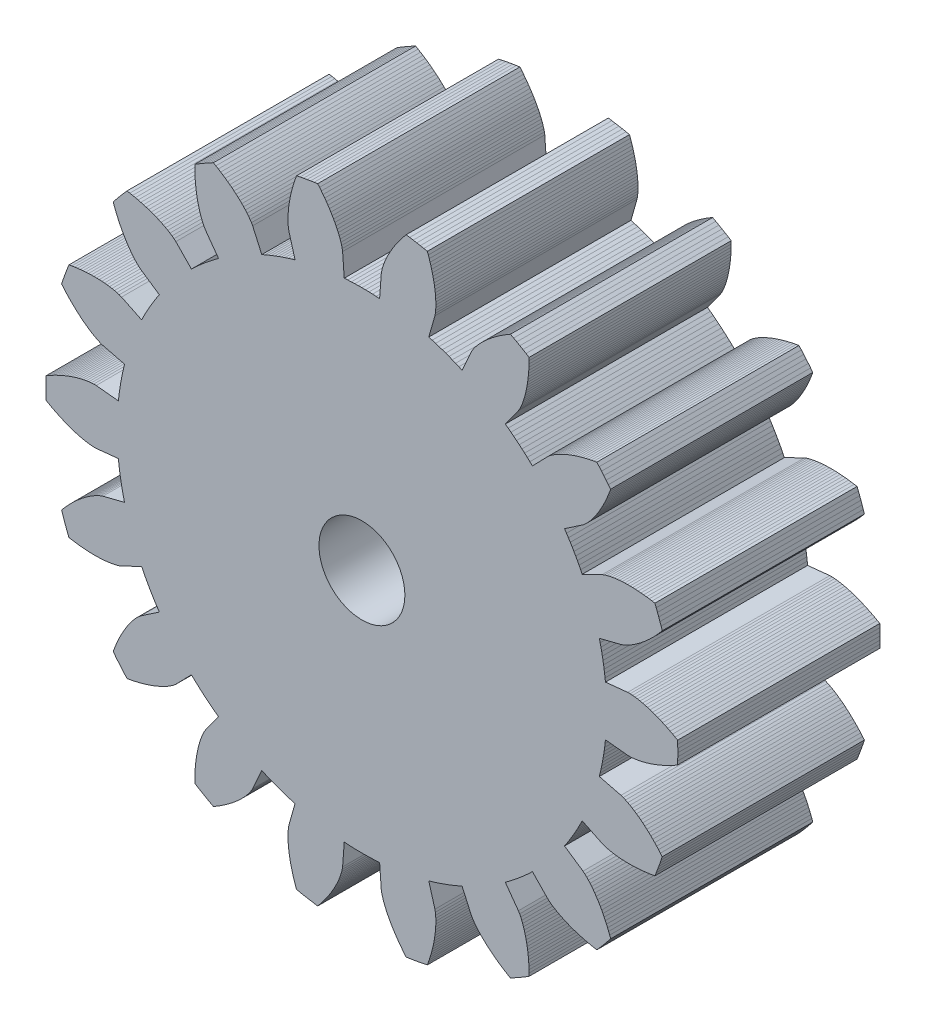
from build123d import *

# Parameters (mm, degrees)
GEAR_PROFILE_M1_25_Z18_R = 1.7
GEAR_BODY_8MM_DEPTH      = 8


with BuildPart() as part:
    # Gear Profile m1. 25 z18 → Gear body 8mm (new body)
    with BuildSketch(Plane.XY):
        Polygon((9.636980636, -0.988058941), (10.516412427, -1.078225195), (10.613218889, -1.07937926), (10.710753758, -1.073218678), (10.808746631, -1.062169966), (10.907089809, -1.047072003), (11.005713175, -1.028396453), (11.104563136, -1.006453141), (11.203595091, -0.981463589), (11.302769944, -0.953595023), (11.40205224, -0.922978585), (11.501409069, -0.889720074), (11.600809369, -0.853906748), (11.700223467, -0.815611865), (11.799622753, -0.77489784), (11.898979455, -0.731818518), (11.998266467, -0.686420855), (12.097457222, -0.638746191), (12.196525595, -0.588831234), (12.295445827, -0.536708834), (12.394192463, -0.482408597), (12.492740304, -0.425957384), (12.496773295, -0.284002137), (12.499193298, -0.142010233), (12.5, 0), (12.499193298, 0.142010233), (12.496773295, 0.284002137), (12.492740304, 0.425957384), (12.394192463, 0.482408597), (12.295445827, 0.536708834), (12.196525595, 0.588831234), (12.097457222, 0.638746191), (11.998266467, 0.686420855), (11.898979455, 0.731818518), (11.799622753, 0.77489784), (11.700223467, 0.815611865), (11.600809369, 0.853906748), (11.501409069, 0.889720074), (11.40205224, 0.922978585), (11.302769944, 0.953595023), (11.203595091, 0.981463589), (11.104563136, 1.006453141), (11.005713175, 1.028396453), (10.907089809, 1.047072003), (10.808746631, 1.062169966), (10.710753758, 1.073218678), (10.613218889, 1.07937926), (10.516412427, 1.078225195), (9.636980636, 0.988058941), (9.621672316, 1.127420989), (9.604348765, 1.266546903), (9.585013609, 1.405407542), (9.5636709, 1.543973822), (9.540325107, 1.682216721), (9.51498112, 1.820107285), (9.487644248, 1.957616632), (9.458320215, 2.094715962), (9.427015164, 2.23137656), (9.393735651, 2.367569803), (10.250969891, 2.583624627), (10.342332922, 2.61564992), (10.431878675, 2.654797864), (10.520182973, 2.698695793), (10.607431524, 2.746518585), (10.693719759, 2.797799039), (10.779103284, 2.852227685), (10.863615951, 2.909581107), (10.947278217, 2.96968879), (11.03010162, 3.032415376), (11.112091418, 3.09765019), (11.193248268, 3.165300613), (11.27356934, 3.235287656), (11.353049099, 3.307542883), (11.431679863, 3.382006198), (11.50945222, 3.458624205), (11.586355345, 3.537348971), (11.662377244, 3.618137067), (11.737504946, 3.700948813), (11.811724655, 3.785747684), (11.885021883, 3.872499819), (11.840260101, 4.007273481), (11.793970068, 4.141529915), (11.74615776, 4.275251792), (11.696829347, 4.408421851), (11.645991197, 4.541022906), (11.593649872, 4.67303784), (11.48173774, 4.692379281), (11.370374481, 4.709631475), (11.259592958, 4.724777798), (11.149427218, 4.737799135), (11.039912702, 4.748673428), (10.931086514, 4.75737512), (10.822987759, 4.763874447), (10.715657966, 4.768136558), (10.609141651, 4.770120353), (10.503487043, 4.769776966), (10.398747084, 4.767047707), (10.294980804, 4.761861202), (10.192255316, 4.754129291), (10.090648789, 4.743740865), (9.990255154, 4.730552156), (9.891192091, 4.714370254), (9.793615925, 4.69492235), (9.697753864, 4.671789207), (9.603994024, 4.644219371), (9.51342042, 4.610025145), (8.71786353, 4.224513194), (8.655813787, 4.350234929), (8.591951108, 4.47504552), (8.52628887, 4.598918825), (8.458840825, 4.721828899), (8.389621099, 4.84375), (8.318644191, 4.964656591), (8.245924967, 5.084523349), (8.171478657, 5.203325168), (8.095320854, 5.321037165), (8.01746751, 5.437634687), (8.749109097, 5.933851188), (8.824008968, 5.995193117), (8.894765066, 6.062606602), (8.962729987, 6.134059011), (9.028360449, 6.208838498), (9.091905918, 6.286538676), (9.153524493, 6.366887759), (9.213324397, 6.449687381), (9.271383173, 6.534784307), (9.327757957, 6.622055289), (9.382491545, 6.711398125), (9.43561623, 6.802726006), (9.487156371, 6.895963738), (9.537130171, 6.99104512), (9.585550966, 7.087911052), (9.632428174, 7.186508141), (9.677768018, 7.286787641), (9.721574079, 7.388704639), (9.76384774, 7.492217413), (9.804588532, 7.597286922), (9.843794418, 7.703876392), (9.755636794, 7.815212776), (9.666219988, 7.925540433), (9.575555539, 8.034845121), (9.483655151, 8.143112733), (9.390530685, 8.250329294), (9.296194161, 8.356480966), (9.184415994, 8.336379772), (9.073868163, 8.314503053), (8.964587236, 8.290846429), (8.856611744, 8.265403581), (8.749982533, 8.238165904), (8.644743214, 8.20912207), (8.54094071, 8.178257489), (8.438625969, 8.145553612), (8.337854876, 8.110987044), (8.238689466, 8.074528362), (8.14119956, 8.036140521), (8.045465042, 7.995776643), (7.951579129, 7.953376837), (7.859653275, 7.908863431), (7.769824922, 7.862133453), (7.682270629, 7.813045876), (7.5972306, 7.76139781), (7.515061729, 7.70687301), (7.43638574, 7.648898085), (7.362969506, 7.585788026), (6.74724342, 6.951428809), (6.645936369, 7.048346333), (6.543237345, 7.143787602), (6.439167858, 7.237732624), (6.333749707, 7.330161724), (6.227004969, 7.421055543), (6.118956003, 7.510395042), (6.009625438, 7.59816151), (5.899036175, 7.684336566), (5.787211376, 7.768902158), (5.674174461, 7.851840576), (6.191976624, 8.568367721), (6.241379304, 8.651627544), (6.284811518, 8.739175509), (6.324239489, 8.829564182), (6.360335858, 8.922280855), (6.393474041, 9.017028969), (6.423895556, 9.113607203), (6.451769946, 9.211866169), (6.477222487, 9.311688393), (6.500349022, 9.412977602), (6.521224721, 9.515652396), (6.539909621, 9.619642244), (6.556452328, 9.72488482), (6.570892591, 9.831324139), (6.583263155, 9.938909228), (6.593591131, 10.047593134), (6.601899039, 10.15733218), (6.608205605, 10.268085386), (6.612526399, 10.37981402), (6.614874331, 10.492481233), (6.615260068, 10.606051774), (6.494339713, 10.68052207), (6.372581119, 10.753613806), (6.25, 10.825317547), (6.126612179, 10.895624039), (6.002433582, 10.964524207), (5.877480237, 11.032009158), (5.779318131, 10.974889831), (5.682919429, 10.916522854), (5.58831999, 10.856916621), (5.495558183, 10.796078371), (5.404675336, 10.734013989), (5.3157163, 10.670727746), (5.228730162, 10.606221979), (5.143771139, 10.540496685), (5.060899748, 10.473548992), (4.980184348, 10.40537247), (4.901703218, 10.335956188), (4.825547457, 10.265283416), (4.751825145, 10.193329757), (4.68066758, 10.120060345), (4.612239134, 10.045425423), (4.546753951, 9.969352857), (4.484507142, 9.891734148), (4.42594224, 9.812394187), (4.371839586, 9.731006804), (4.324435804, 9.646592916), (3.962806175, 8.839899517), (3.834460941, 8.896323148), (3.705312589, 8.950883468), (3.575388171, 9.003569052), (3.444714898, 9.054368864), (3.313320138, 9.103272264), (3.181231414, 9.150269009), (3.048476389, 9.195349257), (2.91508287, 9.238503564), (2.781078795, 9.279722894), (2.646492231, 9.318998611), (2.888000385, 10.169412652), (2.905947183, 10.264548005), (2.916816946, 10.361670874), (2.922952372, 10.460093603), (2.925160895, 10.559564462), (2.923894837, 10.659932492), (2.919450009, 10.761091117), (2.912036822, 10.862957944), (2.901813175, 10.965465433), (2.88890206, 11.068555897), (2.873401952, 11.172178552), (2.855393392, 11.276287657), (2.834943371, 11.380841268), (2.812108389, 11.485800372), (2.786936649, 11.591128268), (2.759469687, 11.696790109), (2.729743602, 11.802752552), (2.697790008, 11.908983495), (2.663636783, 12.015451866), (2.627308661, 12.122127456), (2.588827722, 12.228980784), (2.449729416, 12.257602775), (2.310314917, 12.284642648), (2.170602221, 12.310096913), (2.03060936, 12.333962284), (1.890354403, 12.356235682), (1.749855454, 12.376914231), (1.677149208, 12.289666203), (1.60652674, 12.201848888), (1.538018879, 12.113482437), (1.4716592, 12.024586776), (1.407484528, 11.93518157), (1.345535548, 11.845286172), (1.285857588, 11.754919567), (1.228501595, 11.664100296), (1.173525421, 11.572846359), (1.120995499, 11.481175091), (1.070989127, 11.389102995), (1.023597632, 11.296645509), (0.97893092, 11.203816671), (0.937124296, 11.110628624), (0.898349236, 11.017090832), (0.862831643, 10.923208752), (0.830885938, 10.828981361), (0.802988797, 10.734395809), (0.779985056, 10.639412488), (0.764311322, 10.543876333), (0.70039602, 9.662147881), (0.560492933, 9.671272094), (0.420472451, 9.678370688), (0.280363903, 9.683442174), (0.140196633, 9.68648549), (0, 9.6875), (-0.140196633, 9.68648549), (-0.280363903, 9.683442174), (-0.420472451, 9.678370688), (-0.560492933, 9.671272094), (-0.70039602, 9.662147881), (-0.764311322, 10.543876333), (-0.779985056, 10.639412488), (-0.802988797, 10.734395809), (-0.830885938, 10.828981361), (-0.862831643, 10.923208752), (-0.898349236, 11.017090832), (-0.937124296, 11.110628624), (-0.97893092, 11.203816671), (-1.023597632, 11.296645509), (-1.070989127, 11.389102995), (-1.120995499, 11.481175091), (-1.173525421, 11.572846359), (-1.228501595, 11.664100296), (-1.285857588, 11.754919567), (-1.345535548, 11.845286172), (-1.407484528, 11.93518157), (-1.4716592, 12.024586776), (-1.538018879, 12.113482437), (-1.60652674, 12.201848888), (-1.677149208, 12.289666203), (-1.749855454, 12.376914231), (-1.890354403, 12.356235682), (-2.03060936, 12.333962284), (-2.170602221, 12.310096913), (-2.310314917, 12.284642648), (-2.449729416, 12.257602775), (-2.588827722, 12.228980784), (-2.627308661, 12.122127456), (-2.663636783, 12.015451866), (-2.697790008, 11.908983495), (-2.729743602, 11.802752552), (-2.759469687, 11.696790109), (-2.786936649, 11.591128268), (-2.812108389, 11.485800372), (-2.834943371, 11.380841268), (-2.855393392, 11.276287657), (-2.873401952, 11.172178552), (-2.88890206, 11.068555897), (-2.901813175, 10.965465433), (-2.912036822, 10.862957944), (-2.919450009, 10.761091117), (-2.923894837, 10.659932492), (-2.925160895, 10.559564462), (-2.922952372, 10.460093603), (-2.916816946, 10.361670874), (-2.905947183, 10.264548005), (-2.888000385, 10.169412652), (-2.646492231, 9.318998611), (-2.781078795, 9.279722894), (-2.91508287, 9.238503564), (-3.048476389, 9.195349257), (-3.181231414, 9.150269009), (-3.313320138, 9.103272264), (-3.444714898, 9.054368864), (-3.575388171, 9.003569052), (-3.705312589, 8.950883468), (-3.834460941, 8.896323148), (-3.962806175, 8.839899517), (-4.324435804, 9.646592916), (-4.371839586, 9.731006804), (-4.42594224, 9.812394187), (-4.484507142, 9.891734148), (-4.546753951, 9.969352857), (-4.612239134, 10.045425423), (-4.68066758, 10.120060345), (-4.751825145, 10.193329757), (-4.825547457, 10.265283416), (-4.901703218, 10.335956188), (-4.980184348, 10.40537247), (-5.060899748, 10.473548992), (-5.143771139, 10.540496685), (-5.228730162, 10.606221979), (-5.3157163, 10.670727746), (-5.404675336, 10.734013989), (-5.495558183, 10.796078371), (-5.58831999, 10.856916621), (-5.682919429, 10.916522854), (-5.779318131, 10.974889831), (-5.877480237, 11.032009158), (-6.002433582, 10.964524207), (-6.126612179, 10.895624039), (-6.25, 10.825317547), (-6.372581119, 10.753613806), (-6.494339713, 10.68052207), (-6.615260068, 10.606051774), (-6.614874331, 10.492481233), (-6.612526399, 10.37981402), (-6.608205605, 10.268085386), (-6.601899039, 10.15733218), (-6.593591131, 10.047593134), (-6.583263155, 9.938909228), (-6.570892591, 9.831324139), (-6.556452328, 9.72488482), (-6.539909621, 9.619642244), (-6.521224721, 9.515652396), (-6.500349022, 9.412977602), (-6.477222487, 9.311688393), (-6.451769946, 9.211866169), (-6.423895556, 9.113607203), (-6.393474041, 9.017028969), (-6.360335858, 8.922280855), (-6.324239489, 8.829564182), (-6.284811518, 8.739175509), (-6.241379304, 8.651627544), (-6.191976624, 8.568367721), (-5.674174461, 7.851840576), (-5.787211376, 7.768902158), (-5.899036175, 7.684336566), (-6.009625438, 7.59816151), (-6.118956003, 7.510395042), (-6.227004969, 7.421055543), (-6.333749707, 7.330161724), (-6.439167858, 7.237732624), (-6.543237345, 7.143787602), (-6.645936369, 7.048346333), (-6.74724342, 6.951428809), (-7.362969506, 7.585788026), (-7.43638574, 7.648898085), (-7.515061729, 7.70687301), (-7.5972306, 7.76139781), (-7.682270629, 7.813045876), (-7.769824922, 7.862133453), (-7.859653275, 7.908863431), (-7.951579129, 7.953376837), (-8.045465042, 7.995776643), (-8.14119956, 8.036140521), (-8.238689466, 8.074528362), (-8.337854876, 8.110987044), (-8.438625969, 8.145553612), (-8.54094071, 8.178257489), (-8.644743214, 8.20912207), (-8.749982533, 8.238165904), (-8.856611744, 8.265403581), (-8.964587236, 8.290846429), (-9.073868163, 8.314503053), (-9.184415994, 8.336379772), (-9.296194161, 8.356480966), (-9.390530685, 8.250329294), (-9.483655151, 8.143112733), (-9.575555539, 8.034845121), (-9.666219988, 7.925540433), (-9.755636794, 7.815212776), (-9.843794418, 7.703876392), (-9.804588532, 7.597286922), (-9.76384774, 7.492217413), (-9.721574079, 7.388704639), (-9.677768018, 7.286787641), (-9.632428174, 7.186508141), (-9.585550966, 7.087911052), (-9.537130171, 6.99104512), (-9.487156371, 6.895963738), (-9.43561623, 6.802726006), (-9.382491545, 6.711398125), (-9.327757957, 6.622055289), (-9.271383173, 6.534784307), (-9.213324397, 6.449687381), (-9.153524493, 6.366887759), (-9.091905918, 6.286538676), (-9.028360449, 6.208838498), (-8.962729987, 6.134059011), (-8.894765066, 6.062606602), (-8.824008968, 5.995193117), (-8.749109097, 5.933851188), (-8.01746751, 5.437634687), (-8.095320854, 5.321037165), (-8.171478657, 5.203325168), (-8.245924967, 5.084523349), (-8.318644191, 4.964656591), (-8.389621099, 4.84375), (-8.458840825, 4.721828899), (-8.52628887, 4.598918825), (-8.591951108, 4.47504552), (-8.655813787, 4.350234929), (-8.71786353, 4.224513194), (-9.51342042, 4.610025145), (-9.603994024, 4.644219371), (-9.697753864, 4.671789207), (-9.793615925, 4.69492235), (-9.891192091, 4.714370254), (-9.990255154, 4.730552156), (-10.090648789, 4.743740865), (-10.192255316, 4.754129291), (-10.294980804, 4.761861202), (-10.398747084, 4.767047707), (-10.503487043, 4.769776966), (-10.609141651, 4.770120353), (-10.715657966, 4.768136558), (-10.822987759, 4.763874447), (-10.931086514, 4.75737512), (-11.039912702, 4.748673428), (-11.149427218, 4.737799135), (-11.259592958, 4.724777798), (-11.370374481, 4.709631475), (-11.48173774, 4.692379281), (-11.593649872, 4.67303784), (-11.645991197, 4.541022906), (-11.696829347, 4.408421851), (-11.74615776, 4.275251792), (-11.793970068, 4.141529915), (-11.840260101, 4.007273481), (-11.885021883, 3.872499819), (-11.811724655, 3.785747684), (-11.737504946, 3.700948813), (-11.662377244, 3.618137067), (-11.586355345, 3.537348971), (-11.50945222, 3.458624205), (-11.431679863, 3.382006198), (-11.353049099, 3.307542883), (-11.27356934, 3.235287656), (-11.193248268, 3.165300613), (-11.112091418, 3.09765019), (-11.03010162, 3.032415376), (-10.947278217, 2.96968879), (-10.863615951, 2.909581107), (-10.779103284, 2.852227685), (-10.693719759, 2.797799039), (-10.607431524, 2.746518585), (-10.520182973, 2.698695793), (-10.431878675, 2.654797864), (-10.342332922, 2.61564992), (-10.250969891, 2.583624627), (-9.393735651, 2.367569803), (-9.427015164, 2.23137656), (-9.458320215, 2.094715962), (-9.487644248, 1.957616632), (-9.51498112, 1.820107285), (-9.540325107, 1.682216721), (-9.5636709, 1.543973822), (-9.585013609, 1.405407542), (-9.604348765, 1.266546903), (-9.621672316, 1.127420989), (-9.636980636, 0.988058941), (-10.516412427, 1.078225195), (-10.613218889, 1.07937926), (-10.710753758, 1.073218678), (-10.808746631, 1.062169966), (-10.907089809, 1.047072003), (-11.005713175, 1.028396453), (-11.104563136, 1.006453141), (-11.203595091, 0.981463589), (-11.302769944, 0.953595023), (-11.40205224, 0.922978585), (-11.501409069, 0.889720074), (-11.600809369, 0.853906748), (-11.700223467, 0.815611865), (-11.799622753, 0.77489784), (-11.898979455, 0.731818518), (-11.998266467, 0.686420855), (-12.097457222, 0.638746191), (-12.196525595, 0.588831234), (-12.295445827, 0.536708834), (-12.394192463, 0.482408597), (-12.492740304, 0.425957384), (-12.496773295, 0.284002137), (-12.499193298, 0.142010233), (-12.5, 0), (-12.499193298, -0.142010233), (-12.496773295, -0.284002137), (-12.492740304, -0.425957384), (-12.394192463, -0.482408597), (-12.295445827, -0.536708834), (-12.196525595, -0.588831234), (-12.097457222, -0.638746191), (-11.998266467, -0.686420855), (-11.898979455, -0.731818518), (-11.799622753, -0.77489784), (-11.700223467, -0.815611865), (-11.600809369, -0.853906748), (-11.501409069, -0.889720074), (-11.40205224, -0.922978585), (-11.302769944, -0.953595023), (-11.203595091, -0.981463589), (-11.104563136, -1.006453141), (-11.005713175, -1.028396453), (-10.907089809, -1.047072003), (-10.808746631, -1.062169966), (-10.710753758, -1.073218678), (-10.613218889, -1.07937926), (-10.516412427, -1.078225195), (-9.636980636, -0.988058941), (-9.621672316, -1.127420989), (-9.604348765, -1.266546903), (-9.585013609, -1.405407542), (-9.5636709, -1.543973822), (-9.540325107, -1.682216721), (-9.51498112, -1.820107285), (-9.487644248, -1.957616632), (-9.458320215, -2.094715962), (-9.427015164, -2.23137656), (-9.393735651, -2.367569803), (-10.250969891, -2.583624627), (-10.342332922, -2.61564992), (-10.431878675, -2.654797864), (-10.520182973, -2.698695793), (-10.607431524, -2.746518585), (-10.693719759, -2.797799039), (-10.779103284, -2.852227685), (-10.863615951, -2.909581107), (-10.947278217, -2.96968879), (-11.03010162, -3.032415376), (-11.112091418, -3.09765019), (-11.193248268, -3.165300613), (-11.27356934, -3.235287656), (-11.353049099, -3.307542883), (-11.431679863, -3.382006198), (-11.50945222, -3.458624205), (-11.586355345, -3.537348971), (-11.662377244, -3.618137067), (-11.737504946, -3.700948813), (-11.811724655, -3.785747684), (-11.885021883, -3.872499819), (-11.840260101, -4.007273481), (-11.793970068, -4.141529915), (-11.74615776, -4.275251792), (-11.696829347, -4.408421851), (-11.645991197, -4.541022906), (-11.593649872, -4.67303784), (-11.48173774, -4.692379281), (-11.370374481, -4.709631475), (-11.259592958, -4.724777798), (-11.149427218, -4.737799135), (-11.039912702, -4.748673428), (-10.931086514, -4.75737512), (-10.822987759, -4.763874447), (-10.715657966, -4.768136558), (-10.609141651, -4.770120353), (-10.503487043, -4.769776966), (-10.398747084, -4.767047707), (-10.294980804, -4.761861202), (-10.192255316, -4.754129291), (-10.090648789, -4.743740865), (-9.990255154, -4.730552156), (-9.891192091, -4.714370254), (-9.793615925, -4.69492235), (-9.697753864, -4.671789207), (-9.603994024, -4.644219371), (-9.51342042, -4.610025145), (-8.71786353, -4.224513194), (-8.655813787, -4.350234929), (-8.591951108, -4.47504552), (-8.52628887, -4.598918825), (-8.458840825, -4.721828899), (-8.389621099, -4.84375), (-8.318644191, -4.964656591), (-8.245924967, -5.084523349), (-8.171478657, -5.203325168), (-8.095320854, -5.321037165), (-8.01746751, -5.437634687), (-8.749109097, -5.933851188), (-8.824008968, -5.995193117), (-8.894765066, -6.062606602), (-8.962729987, -6.134059011), (-9.028360449, -6.208838498), (-9.091905918, -6.286538676), (-9.153524493, -6.366887759), (-9.213324397, -6.449687381), (-9.271383173, -6.534784307), (-9.327757957, -6.622055289), (-9.382491545, -6.711398125), (-9.43561623, -6.802726006), (-9.487156371, -6.895963738), (-9.537130171, -6.99104512), (-9.585550966, -7.087911052), (-9.632428174, -7.186508141), (-9.677768018, -7.286787641), (-9.721574079, -7.388704639), (-9.76384774, -7.492217413), (-9.804588532, -7.597286922), (-9.843794418, -7.703876392), (-9.755636794, -7.815212776), (-9.666219988, -7.925540433), (-9.575555539, -8.034845121), (-9.483655151, -8.143112733), (-9.390530685, -8.250329294), (-9.296194161, -8.356480966), (-9.184415994, -8.336379772), (-9.073868163, -8.314503053), (-8.964587236, -8.290846429), (-8.856611744, -8.265403581), (-8.749982533, -8.238165904), (-8.644743214, -8.20912207), (-8.54094071, -8.178257489), (-8.438625969, -8.145553612), (-8.337854876, -8.110987044), (-8.238689466, -8.074528362), (-8.14119956, -8.036140521), (-8.045465042, -7.995776643), (-7.951579129, -7.953376837), (-7.859653275, -7.908863431), (-7.769824922, -7.862133453), (-7.682270629, -7.813045876), (-7.5972306, -7.76139781), (-7.515061729, -7.70687301), (-7.43638574, -7.648898085), (-7.362969506, -7.585788026), (-6.74724342, -6.951428809), (-6.645936369, -7.048346333), (-6.543237345, -7.143787602), (-6.439167858, -7.237732624), (-6.333749707, -7.330161724), (-6.227004969, -7.421055543), (-6.118956003, -7.510395042), (-6.009625438, -7.59816151), (-5.899036175, -7.684336566), (-5.787211376, -7.768902158), (-5.674174461, -7.851840576), (-6.191976624, -8.568367721), (-6.241379304, -8.651627544), (-6.284811518, -8.739175509), (-6.324239489, -8.829564182), (-6.360335858, -8.922280855), (-6.393474041, -9.017028969), (-6.423895556, -9.113607203), (-6.451769946, -9.211866169), (-6.477222487, -9.311688393), (-6.500349022, -9.412977602), (-6.521224721, -9.515652396), (-6.539909621, -9.619642244), (-6.556452328, -9.72488482), (-6.570892591, -9.831324139), (-6.583263155, -9.938909228), (-6.593591131, -10.047593134), (-6.601899039, -10.15733218), (-6.608205605, -10.268085386), (-6.612526399, -10.37981402), (-6.614874331, -10.492481233), (-6.615260068, -10.606051774), (-6.494339713, -10.68052207), (-6.372581119, -10.753613806), (-6.25, -10.825317547), (-6.126612179, -10.895624039), (-6.002433582, -10.964524207), (-5.877480237, -11.032009158), (-5.779318131, -10.974889831), (-5.682919429, -10.916522854), (-5.58831999, -10.856916621), (-5.495558183, -10.796078371), (-5.404675336, -10.734013989), (-5.3157163, -10.670727746), (-5.228730162, -10.606221979), (-5.143771139, -10.540496685), (-5.060899748, -10.473548992), (-4.980184348, -10.40537247), (-4.901703218, -10.335956188), (-4.825547457, -10.265283416), (-4.751825145, -10.193329757), (-4.68066758, -10.120060345), (-4.612239134, -10.045425423), (-4.546753951, -9.969352857), (-4.484507142, -9.891734148), (-4.42594224, -9.812394187), (-4.371839586, -9.731006804), (-4.324435804, -9.646592916), (-3.962806175, -8.839899517), (-3.834460941, -8.896323148), (-3.705312589, -8.950883468), (-3.575388171, -9.003569052), (-3.444714898, -9.054368864), (-3.313320138, -9.103272264), (-3.181231414, -9.150269009), (-3.048476389, -9.195349257), (-2.91508287, -9.238503564), (-2.781078795, -9.279722894), (-2.646492231, -9.318998611), (-2.888000385, -10.169412652), (-2.905947183, -10.264548005), (-2.916816946, -10.361670874), (-2.922952372, -10.460093603), (-2.925160895, -10.559564462), (-2.923894837, -10.659932492), (-2.919450009, -10.761091117), (-2.912036822, -10.862957944), (-2.901813175, -10.965465433), (-2.88890206, -11.068555897), (-2.873401952, -11.172178552), (-2.855393392, -11.276287657), (-2.834943371, -11.380841268), (-2.812108389, -11.485800372), (-2.786936649, -11.591128268), (-2.759469687, -11.696790109), (-2.729743602, -11.802752552), (-2.697790008, -11.908983495), (-2.663636783, -12.015451866), (-2.627308661, -12.122127456), (-2.588827722, -12.228980784), (-2.449729416, -12.257602775), (-2.310314917, -12.284642648), (-2.170602221, -12.310096913), (-2.03060936, -12.333962284), (-1.890354403, -12.356235682), (-1.749855454, -12.376914231), (-1.677149208, -12.289666203), (-1.60652674, -12.201848888), (-1.538018879, -12.113482437), (-1.4716592, -12.024586776), (-1.407484528, -11.93518157), (-1.345535548, -11.845286172), (-1.285857588, -11.754919567), (-1.228501595, -11.664100296), (-1.173525421, -11.572846359), (-1.120995499, -11.481175091), (-1.070989127, -11.389102995), (-1.023597632, -11.296645509), (-0.97893092, -11.203816671), (-0.937124296, -11.110628624), (-0.898349236, -11.017090832), (-0.862831643, -10.923208752), (-0.830885938, -10.828981361), (-0.802988797, -10.734395809), (-0.779985056, -10.639412488), (-0.764311322, -10.543876333), (-0.70039602, -9.662147881), (-0.560492933, -9.671272094), (-0.420472451, -9.678370688), (-0.280363903, -9.683442174), (-0.140196633, -9.68648549), (0, -9.6875), (0.140196633, -9.68648549), (0.280363903, -9.683442174), (0.420472451, -9.678370688), (0.560492933, -9.671272094), (0.70039602, -9.662147881), (0.764311322, -10.543876333), (0.779985056, -10.639412488), (0.802988797, -10.734395809), (0.830885938, -10.828981361), (0.862831643, -10.923208752), (0.898349236, -11.017090832), (0.937124296, -11.110628624), (0.97893092, -11.203816671), (1.023597632, -11.296645509), (1.070989127, -11.389102995), (1.120995499, -11.481175091), (1.173525421, -11.572846359), (1.228501595, -11.664100296), (1.285857588, -11.754919567), (1.345535548, -11.845286172), (1.407484528, -11.93518157), (1.4716592, -12.024586776), (1.538018879, -12.113482437), (1.60652674, -12.201848888), (1.677149208, -12.289666203), (1.749855454, -12.376914231), (1.890354403, -12.356235682), (2.03060936, -12.333962284), (2.170602221, -12.310096913), (2.310314917, -12.284642648), (2.449729416, -12.257602775), (2.588827722, -12.228980784), (2.627308661, -12.122127456), (2.663636783, -12.015451866), (2.697790008, -11.908983495), (2.729743602, -11.802752552), (2.759469687, -11.696790109), (2.786936649, -11.591128268), (2.812108389, -11.485800372), (2.834943371, -11.380841268), (2.855393392, -11.276287657), (2.873401952, -11.172178552), (2.88890206, -11.068555897), (2.901813175, -10.965465433), (2.912036822, -10.862957944), (2.919450009, -10.761091117), (2.923894837, -10.659932492), (2.925160895, -10.559564462), (2.922952372, -10.460093603), (2.916816946, -10.361670874), (2.905947183, -10.264548005), (2.888000385, -10.169412652), (2.646492231, -9.318998611), (2.781078795, -9.279722894), (2.91508287, -9.238503564), (3.048476389, -9.195349257), (3.181231414, -9.150269009), (3.313320138, -9.103272264), (3.444714898, -9.054368864), (3.575388171, -9.003569052), (3.705312589, -8.950883468), (3.834460941, -8.896323148), (3.962806175, -8.839899517), (4.324435804, -9.646592916), (4.371839586, -9.731006804), (4.42594224, -9.812394187), (4.484507142, -9.891734148), (4.546753951, -9.969352857), (4.612239134, -10.045425423), (4.68066758, -10.120060345), (4.751825145, -10.193329757), (4.825547457, -10.265283416), (4.901703218, -10.335956188), (4.980184348, -10.40537247), (5.060899748, -10.473548992), (5.143771139, -10.540496685), (5.228730162, -10.606221979), (5.3157163, -10.670727746), (5.404675336, -10.734013989), (5.495558183, -10.796078371), (5.58831999, -10.856916621), (5.682919429, -10.916522854), (5.779318131, -10.974889831), (5.877480237, -11.032009158), (6.002433582, -10.964524207), (6.126612179, -10.895624039), (6.25, -10.825317547), (6.372581119, -10.753613806), (6.494339713, -10.68052207), (6.615260068, -10.606051774), (6.614874331, -10.492481233), (6.612526399, -10.37981402), (6.608205605, -10.268085386), (6.601899039, -10.15733218), (6.593591131, -10.047593134), (6.583263155, -9.938909228), (6.570892591, -9.831324139), (6.556452328, -9.72488482), (6.539909621, -9.619642244), (6.521224721, -9.515652396), (6.500349022, -9.412977602), (6.477222487, -9.311688393), (6.451769946, -9.211866169), (6.423895556, -9.113607203), (6.393474041, -9.017028969), (6.360335858, -8.922280855), (6.324239489, -8.829564182), (6.284811518, -8.739175509), (6.241379304, -8.651627544), (6.191976624, -8.568367721), (5.674174461, -7.851840576), (5.787211376, -7.768902158), (5.899036175, -7.684336566), (6.009625438, -7.59816151), (6.118956003, -7.510395042), (6.227004969, -7.421055543), (6.333749707, -7.330161724), (6.439167858, -7.237732624), (6.543237345, -7.143787602), (6.645936369, -7.048346333), (6.74724342, -6.951428809), (7.362969506, -7.585788026), (7.43638574, -7.648898085), (7.515061729, -7.70687301), (7.5972306, -7.76139781), (7.682270629, -7.813045876), (7.769824922, -7.862133453), (7.859653275, -7.908863431), (7.951579129, -7.953376837), (8.045465042, -7.995776643), (8.14119956, -8.036140521), (8.238689466, -8.074528362), (8.337854876, -8.110987044), (8.438625969, -8.145553612), (8.54094071, -8.178257489), (8.644743214, -8.20912207), (8.749982533, -8.238165904), (8.856611744, -8.265403581), (8.964587236, -8.290846429), (9.073868163, -8.314503053), (9.184415994, -8.336379772), (9.296194161, -8.356480966), (9.390530685, -8.250329294), (9.483655151, -8.143112733), (9.575555539, -8.034845121), (9.666219988, -7.925540433), (9.755636794, -7.815212776), (9.843794418, -7.703876392), (9.804588532, -7.597286922), (9.76384774, -7.492217413), (9.721574079, -7.388704639), (9.677768018, -7.286787641), (9.632428174, -7.186508141), (9.585550966, -7.087911052), (9.537130171, -6.99104512), (9.487156371, -6.895963738), (9.43561623, -6.802726006), (9.382491545, -6.711398125), (9.327757957, -6.622055289), (9.271383173, -6.534784307), (9.213324397, -6.449687381), (9.153524493, -6.366887759), (9.091905918, -6.286538676), (9.028360449, -6.208838498), (8.962729987, -6.134059011), (8.894765066, -6.062606602), (8.824008968, -5.995193117), (8.749109097, -5.933851188), (8.01746751, -5.437634687), (8.095320854, -5.321037165), (8.171478657, -5.203325168), (8.245924967, -5.084523349), (8.318644191, -4.964656591), (8.389621099, -4.84375), (8.458840825, -4.721828899), (8.52628887, -4.598918825), (8.591951108, -4.47504552), (8.655813787, -4.350234929), (8.71786353, -4.224513194), (9.51342042, -4.610025145), (9.603994024, -4.644219371), (9.697753864, -4.671789207), (9.793615925, -4.69492235), (9.891192091, -4.714370254), (9.990255154, -4.730552156), (10.090648789, -4.743740865), (10.192255316, -4.754129291), (10.294980804, -4.761861202), (10.398747084, -4.767047707), (10.503487043, -4.769776966), (10.609141651, -4.770120353), (10.715657966, -4.768136558), (10.822987759, -4.763874447), (10.931086514, -4.75737512), (11.039912702, -4.748673428), (11.149427218, -4.737799135), (11.259592958, -4.724777798), (11.370374481, -4.709631475), (11.48173774, -4.692379281), (11.593649872, -4.67303784), (11.645991197, -4.541022906), (11.696829347, -4.408421851), (11.74615776, -4.275251792), (11.793970068, -4.141529915), (11.840260101, -4.007273481), (11.885021883, -3.872499819), (11.811724655, -3.785747684), (11.737504946, -3.700948813), (11.662377244, -3.618137067), (11.586355345, -3.537348971), (11.50945222, -3.458624205), (11.431679863, -3.382006198), (11.353049099, -3.307542883), (11.27356934, -3.235287656), (11.193248268, -3.165300613), (11.112091418, -3.09765019), (11.03010162, -3.032415376), (10.947278217, -2.96968879), (10.863615951, -2.909581107), (10.779103284, -2.852227685), (10.693719759, -2.797799039), (10.607431524, -2.746518585), (10.520182973, -2.698695793), (10.431878675, -2.654797864), (10.342332922, -2.61564992), (10.250969891, -2.583624627), (9.393735651, -2.367569803), (9.427015164, -2.23137656), (9.458320215, -2.094715962), (9.487644248, -1.957616632), (9.51498112, -1.820107285), (9.540325107, -1.682216721), (9.5636709, -1.543973822), (9.585013609, -1.405407542), (9.604348765, -1.266546903), (9.621672316, -1.127420989), align=None)
        Circle(GEAR_PROFILE_M1_25_Z18_R, mode=Mode.SUBTRACT)
    extrude(amount=GEAR_BODY_8MM_DEPTH)


solid = part.part
